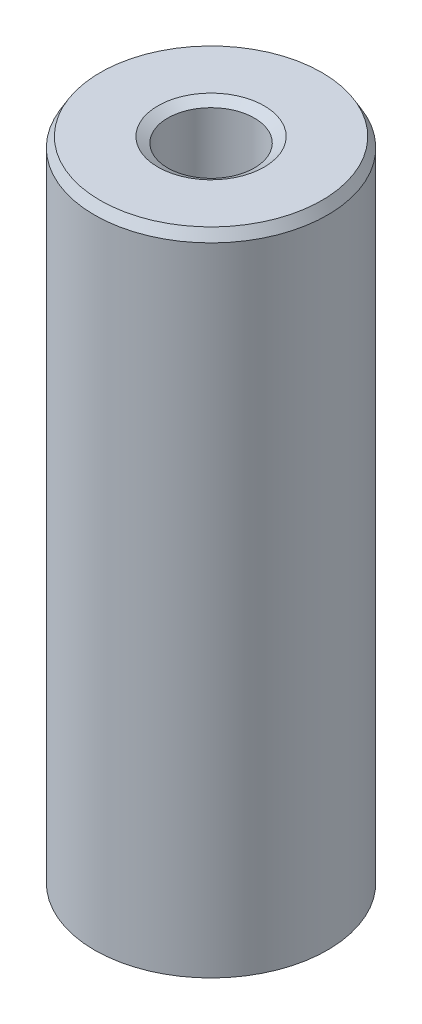
from build123d import *
from OCP.BRepFilletAPI import BRepFilletAPI_MakeChamfer

# Parameters (mm, degrees)
SKETCH1_R           = 22.5
BOSS_EXTRUDE1_DEPTH = 125.94270238
SKETCH2_R           = 8.364264221
CUT_EXTRUDE1_DEPTH  = 130.900208941
CHAMFER1_SIZE       = 1.898897119
CHAMFER1_SIZE2      = 1.096328763


with BuildPart() as part:
    # Sketch1 → Boss-Extrude1 (new body)
    with BuildSketch(Plane(origin=(0, 0, 0), x_dir=(1, 0, 0), z_dir=(0, 1, 0))):
        Circle(SKETCH1_R)
    extrude(amount=BOSS_EXTRUDE1_DEPTH)

    # Sketch2 → Cut-Extrude1 (cut, through all)
    with BuildSketch(Plane(origin=(0, 0, 0), x_dir=(1, 0, 0), z_dir=(0, 1, 0))):
        Circle(SKETCH2_R)
    extrude(amount=CUT_EXTRUDE1_DEPTH, mode=Mode.SUBTRACT)

    # Chamfer1: one chamfer whose edges measure the first distance from different faces: ONE call of the kernel's chamfer builder (chamfer() names one face for all edges)
    chamfer1_edges_1 = [part.edges().sort_by_distance(p)[0] for p in [
        (-8.364264221, 125.94270238, 0),
    ]]
    chamfer1_side_1 = [part.faces().sort_by_distance(p)[0] for p in [
        (-21.863603897, 125.94270238, 0),
    ]]
    chamfer1_edges_2 = [part.edges().sort_by_distance(p)[0] for p in [
        (-8.364264221, 0, 0),
    ]]
    chamfer1_side_2 = [part.faces().sort_by_distance(p)[0] for p in [
        (-8.364264221, 62.97135119, 0),
    ]]
    chamfer1_edges_3 = [part.edges().sort_by_distance(p)[0] for p in [
        (-22.5, 0, 0),
    ]]
    chamfer1_side_3 = [part.faces().sort_by_distance(p)[0] for p in [
        (-21.863603897, 0, 0),
    ]]
    chamfer1_edges_4 = [part.edges().sort_by_distance(p)[0] for p in [
        (-22.5, 125.94270238, 0),
    ]]
    chamfer1_side_4 = [part.faces().sort_by_distance(p)[0] for p in [
        (-22.5, 62.97135119, 0),
    ]]
    chamfer1 = BRepFilletAPI_MakeChamfer(part.part.solid().wrapped)
    for e in chamfer1_edges_1:
        chamfer1.Add(CHAMFER1_SIZE, CHAMFER1_SIZE2, e.wrapped, chamfer1_side_1[0].wrapped)  # the first distance lies on this face
    for e in chamfer1_edges_2:
        chamfer1.Add(CHAMFER1_SIZE, CHAMFER1_SIZE2, e.wrapped, chamfer1_side_2[0].wrapped)  # the first distance lies on this face
    for e in chamfer1_edges_3:
        chamfer1.Add(CHAMFER1_SIZE, CHAMFER1_SIZE2, e.wrapped, chamfer1_side_3[0].wrapped)  # the first distance lies on this face
    for e in chamfer1_edges_4:
        chamfer1.Add(CHAMFER1_SIZE, CHAMFER1_SIZE2, e.wrapped, chamfer1_side_4[0].wrapped)  # the first distance lies on this face
    add(Compound.cast(chamfer1.Shape()), mode=Mode.REPLACE)


solid = part.part
